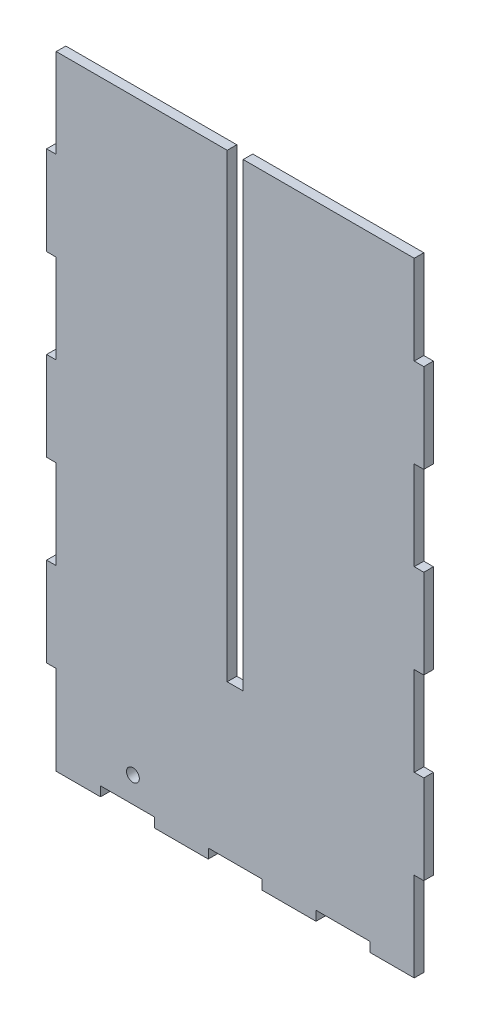
from build123d import *

# Parameters (mm, degrees)
BOSS_EXTRUDE1_DEPTH = 4.7625
SKETCH3_W           = 7.9375
SKETCH3_H           = 228.6
CUT_EXTRUDE1_DEPTH  = 184.017476539
SKETCH4_R           = 3.175
CUT_EXTRUDE2_DEPTH  = 184.017476539


with BuildPart() as part:
    # Sketch2 → Boss-Extrude1 (new body)
    with BuildSketch(Plane.XY):
        Polygon((88.9, 152.4), (-88.9, 152.4), (-88.9, 108.176785714), (-93.6625, 108.176785714), (-93.6625, 63.953571429), (-88.9, 63.953571429), (-88.9, 19.730357143), (-93.6625, 19.730357143), (-93.6625, -24.492857143), (-88.9, -24.492857143), (-88.9, -68.716071429), (-93.6625, -68.716071429), (-93.6625, -112.939285714), (-88.9, -112.939285714), (-88.9, -157.1625), (-66.901785714, -157.1625), (-66.901785714, -152.4), (-40.141071429, -152.4), (-40.141071429, -157.1625), (-13.380357143, -157.1625), (-13.380357143, -152.4), (13.380357143, -152.4), (13.380357143, -157.1625), (40.141071429, -157.1625), (40.141071429, -152.4), (66.901785714, -152.4), (66.901785714, -157.1625), (88.9, -157.1625), (88.9, -112.939285714), (93.6625, -112.939285714), (93.6625, -68.716071429), (88.9, -68.716071429), (88.9, -24.492857143), (93.6625, -24.492857143), (93.6625, 19.730357143), (88.9, 19.730357143), (88.9, 63.953571429), (93.6625, 63.953571429), (93.6625, 108.176785714), (88.9, 108.176785714), align=None)
    extrude(amount=BOSS_EXTRUDE1_DEPTH)

    # Sketch3 → Cut-Extrude1 (cut, through all)
    with BuildSketch(Plane.XY.offset(4.7625)):
        with Locations((0, 38.1)):
            Rectangle(SKETCH3_W, SKETCH3_H)
    extrude(amount=-CUT_EXTRUDE1_DEPTH, mode=Mode.SUBTRACT)

    # Sketch4 → Cut-Extrude2 (cut, through all)
    with BuildSketch(Plane.XY.offset(4.7625)):
        with Locations((-50.8, -139.7)):
            Circle(SKETCH4_R)
    extrude(amount=-CUT_EXTRUDE2_DEPTH, mode=Mode.SUBTRACT)


solid = part.part
